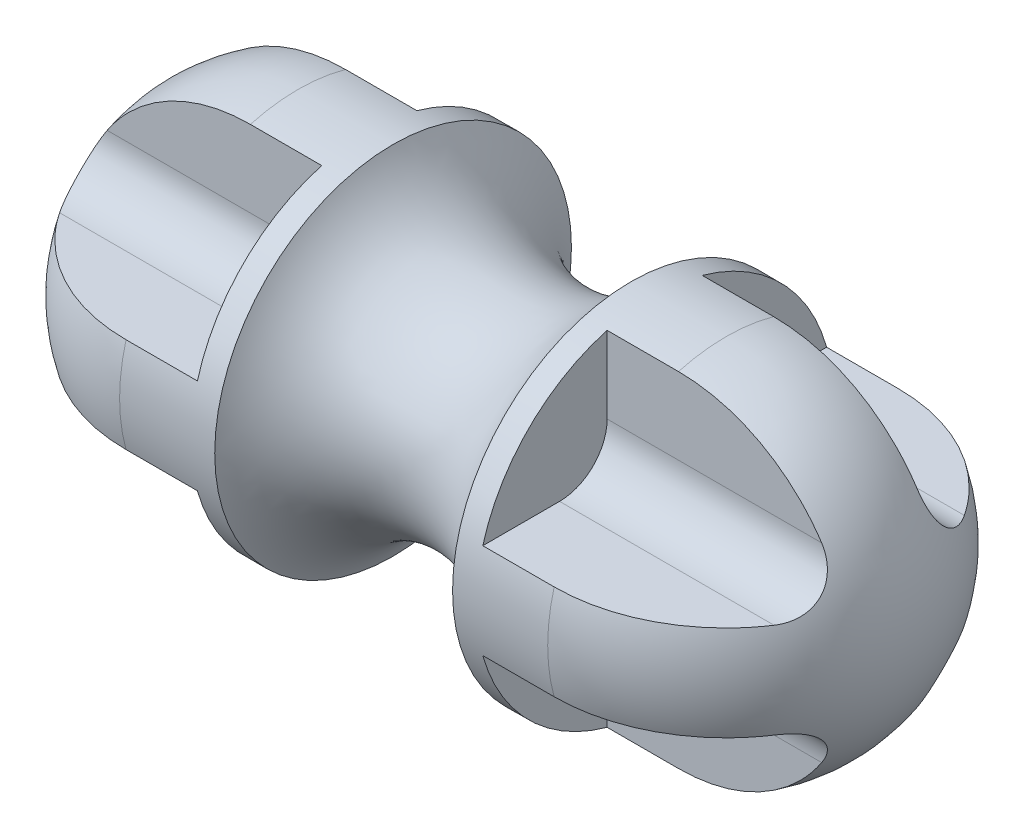
from build123d import *
from build123d.topology import SkipClean

# Parameters (mm, degrees)
CUT_EXTRUDE_START   = -30
CUT_EXTRUDE_1_DEPTH = 52.5


with BuildPart() as part:
    # 草图1 → 旋转3 (revolve)
    with BuildSketch(Plane.XY):
        with BuildLine():
            Line((0, 0), (82.497986241, 0))
            ThreePointArc((82.497986241, 0), (71.515080352, 26.515080352), (45, 37.497986241))
            Line((45, 37.497986241), (25, 37.497986241))
            ThreePointArc((25, 37.497986241), (14.577379737, 26.535686679), (0, 22.497986241))
            Line((0, 22.497986241), (0, 0))
        make_face()
    revolve_3 = revolve(axis=Axis((82.497986241, 0, 0), (1, 0, 0)))

    # 草图2 → 切除-拉伸1 (cut)
    with BuildSketch(Plane.ZY.offset(CUT_EXTRUDE_START)):
        with BuildLine():
            Line((-10, 36.139991314), (-10, 20))
            ThreePointArc((-10, 20), (-12.928932188, 12.928932188), (-20, 10))
            Line((-20, 10), (-36.139991314, 10))
            ThreePointArc((-36.139991314, 10), (-26.515080352, 26.515080352), (-10, 36.139991314))
        make_face()
        with BuildLine():
            Line((36.139991314, 10), (20, 10))
            ThreePointArc((20, 10), (12.928932188, 12.928932188), (10, 20))
            Line((10, 20), (10, 36.139991314))
            ThreePointArc((10, 36.139991314), (26.515080352, 26.515080352), (36.139991314, 10))
        make_face()
        with BuildLine():
            Line((10, -36.139991314), (10, -20))
            ThreePointArc((10, -20), (12.928932188, -12.928932188), (20, -10))
            Line((20, -10), (36.139991314, -10))
            ThreePointArc((36.139991314, -10), (26.515080352, -26.515080352), (10, -36.139991314))
        make_face()
        with BuildLine():
            Line((-36.139991314, -10), (-20, -10))
            ThreePointArc((-20, -10), (-12.928932188, -12.928932188), (-10, -20))
            Line((-10, -20), (-10, -36.139991314))
            ThreePointArc((-10, -36.139991314), (-26.515080352, -26.515080352), (-36.139991314, -10))
        make_face()
    cut_extrude_1 = extrude(amount=-CUT_EXTRUDE_1_DEPTH, mode=Mode.SUBTRACT)

    # 镜向1: 旋转3, 切除-拉伸1 across plane
    with SkipClean():  # the faces are left unmerged after this step: merging them gives an invalid solid
        add(revolve_3.mirror(Plane(origin=(0, 0, 0), x_dir=(0, 0, 1), z_dir=(1, 0, 0))))
        add(cut_extrude_1.mirror(Plane(origin=(0, 0, 0), x_dir=(0, 0, 1), z_dir=(1, 0, 0))), mode=Mode.SUBTRACT)


solid = part.part
